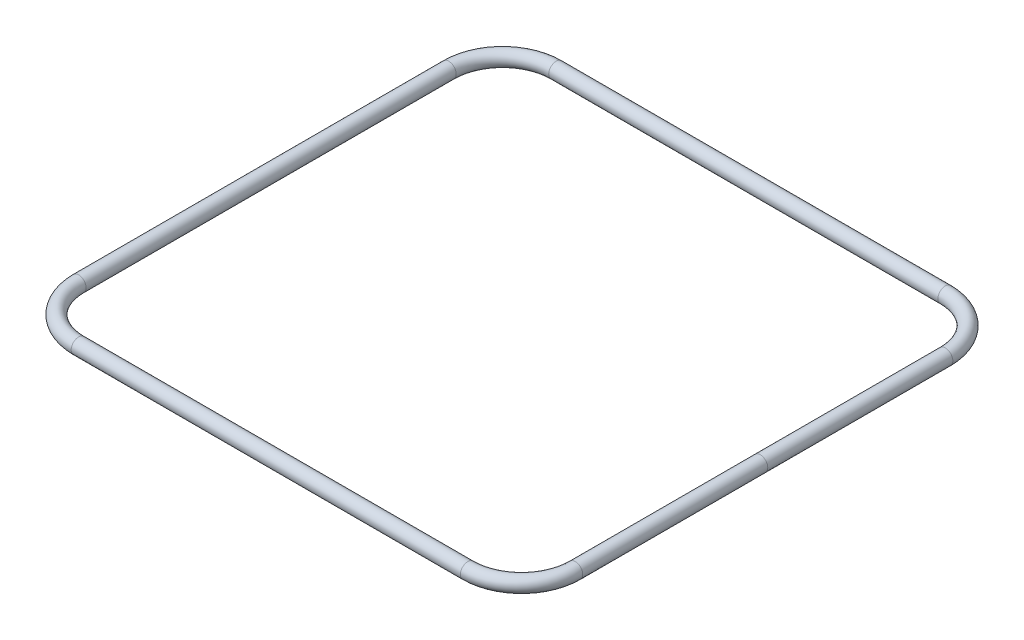
from build123d import *

# Parameters (mm, degrees)
O_RINGPROFILE_R = 1.7653


with BuildPart() as part:
    # Sweep2: sweep along a path in O-RingPath
    with BuildLine(Plane(origin=(0, 0, 0), x_dir=(1, 0, 0), z_dir=(0, 1, 0))) as sweep2_path:
        Line((45.992219207, -56.4388), (-45.992219207, -56.4388))
        ThreePointArc((-45.992219207, -56.4388), (-54.972475328, -52.719056121), (-58.692219207, -43.7388))
        Line((-58.692219207, -43.7388), (-58.692219207, 43.7388))
        ThreePointArc((-58.692219207, 43.7388), (-54.972475328, 52.719056121), (-45.992219207, 56.4388))
        Line((-45.992219207, 56.4388), (45.992219207, 56.4388))
        ThreePointArc((45.992219207, 56.4388), (54.972475328, 52.719056121), (58.692219207, 43.7388))
        Line((58.692219207, 43.7388), (58.692219207, -43.7388))
        ThreePointArc((58.692219207, -43.7388), (54.972475328, -52.719056121), (45.992219207, -56.4388))
    # O-RingProfile → Sweep2 (sweep)
    with BuildSketch(Plane.XY):
        with Locations((58.692219207, 0)):
            Circle(O_RINGPROFILE_R)
    sweep(path=sweep2_path.line)


solid = part.part
